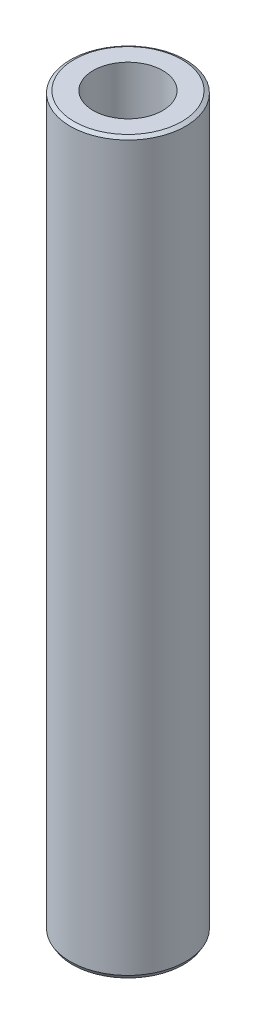
from build123d import *
from OCP.BRepFilletAPI import BRepFilletAPI_MakeChamfer

# Parameters (mm, degrees)
SKETCH1_R           = 27.5
BOSS_EXTRUDE1_DEPTH = 348.103230754
SKETCH2_R           = 16.580088598
CUT_EXTRUDE1_DEPTH  = 351.2689813
CHAMFER1_SIZE       = 1.044623164
CHAMFER1_SIZE2      = 1.809340394


with BuildPart() as part:
    # Sketch1 → Boss-Extrude1 (new body)
    with BuildSketch(Plane(origin=(0, 0, 0), x_dir=(1, 0, 0), z_dir=(0, 1, 0))):
        Circle(SKETCH1_R)
    extrude(amount=BOSS_EXTRUDE1_DEPTH)

    # Sketch2 → Cut-Extrude1 (cut, through all)
    with BuildSketch(Plane(origin=(0, 0, 0), x_dir=(1, 0, 0), z_dir=(0, 1, 0))):
        Circle(SKETCH2_R)
    extrude(amount=CUT_EXTRUDE1_DEPTH, mode=Mode.SUBTRACT)

    # Chamfer1: one chamfer whose edges measure the first distance from different faces: ONE call of the kernel's chamfer builder (chamfer() names one face for all edges)
    chamfer1_edges_1 = [part.edges().sort_by_distance(p)[0] for p in [
        (-27.5, 348.103230754, 0),
    ]]
    chamfer1_side_1 = [part.faces().sort_by_distance(p)[0] for p in [
        (-27.5, 174.051615377, 0),
    ]]
    chamfer1_edges_2 = [part.edges().sort_by_distance(p)[0] for p in [
        (-27.5, 0, 0),
    ]]
    chamfer1_side_2 = [part.faces().sort_by_distance(p)[0] for p in [
        (-26.722182541, 0, 0),
    ]]
    chamfer1 = BRepFilletAPI_MakeChamfer(part.part.solid().wrapped)
    for e in chamfer1_edges_1:
        chamfer1.Add(CHAMFER1_SIZE, CHAMFER1_SIZE2, e.wrapped, chamfer1_side_1[0].wrapped)  # the first distance lies on this face
    for e in chamfer1_edges_2:
        chamfer1.Add(CHAMFER1_SIZE, CHAMFER1_SIZE2, e.wrapped, chamfer1_side_2[0].wrapped)  # the first distance lies on this face
    add(Compound.cast(chamfer1.Shape()), mode=Mode.REPLACE)


solid = part.part
